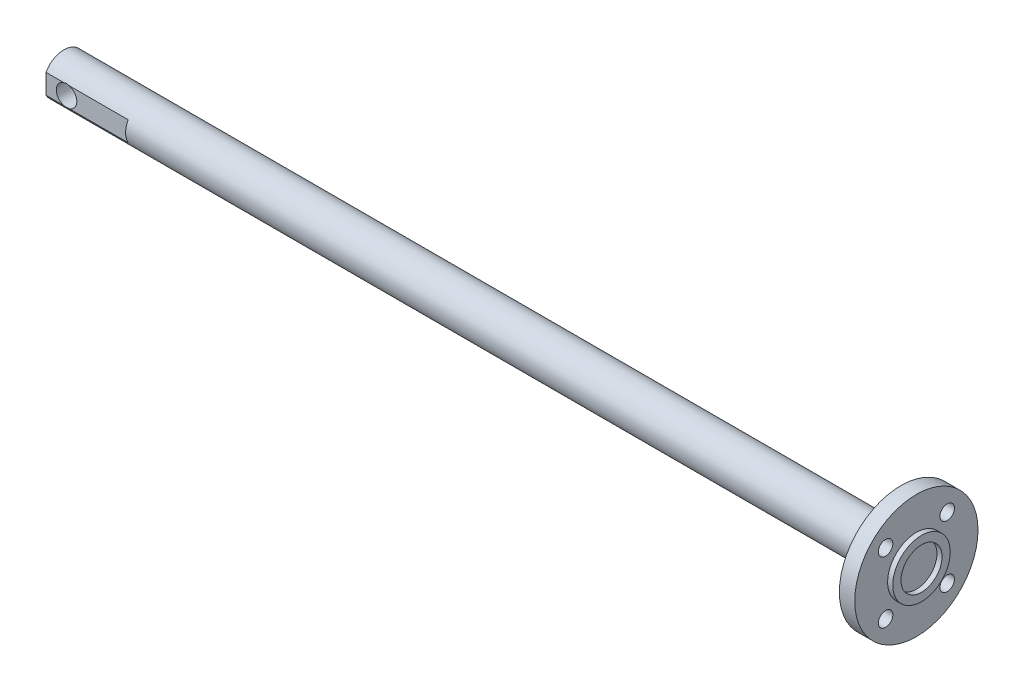
from build123d import *

# Parameters (mm, degrees)
SKETCH1_R                       = 19.05
BOSS_EXTRUDE1_DEPTH             = 263.525
SKETCH2_W                       = 258.7625
SKETCH2_H                       = 12.7
CUT_EXTRUDE1_DEPTH              = 265.898528922
CUT_EXTRUDE1_DEPTH_BACK         = 265.898528922
SKETCH8_W                       = 25.4
SKETCH8_H                       = 0.79375
F_1_1_DIAMETER_HOLE2_D          = 6.35
F_16_0_177_DIAMETER_HOLE1_D     = 4.4958
F_16_0_177_DIAMETER_HOLE1_DEPTH = 25.4
F_16_0_177_DIAMETER_HOLE1_TIP   = 1.350674586
BOSS_EXTRUDE2_START             = 1.5875
SKETCH15_R                      = 8.89
SKETCH15_R_2                    = 6.35
BOSS_EXTRUDE2_DEPTH             = 1.5875


with BuildPart() as part:
    # Sketch1 → Boss-Extrude1 (new body)
    with BuildSketch(Plane(origin=(0, 0, 0), x_dir=(0, 0, -1), z_dir=(1, 0, 0))):
        Circle(SKETCH1_R)
    extrude(amount=BOSS_EXTRUDE1_DEPTH)

    # Sketch2 → Cut-Revolve1 (revolve, cut)
    with BuildSketch(Plane.XY):
        with Locations((129.38125, 12.7)):
            Rectangle(SKETCH2_W, SKETCH2_H)
    revolve(axis=Axis((-16.52066387, 0, 0), (1, 0, 0)), mode=Mode.SUBTRACT)

    # Sketch8 → Cut-Extrude1 (cut, two sides: drawn at the far end of the back side and taken through both)
    with BuildSketch(Plane(origin=(0, 0, 0), x_dir=(1, 0, 0), z_dir=(0, 1, 0)).offset(-CUT_EXTRUDE1_DEPTH_BACK)):
        with Locations((12.7, 5.953125)):
            Rectangle(SKETCH8_W, SKETCH8_H)
        with Locations((12.7, -5.953125)):
            Rectangle(SKETCH8_W, SKETCH8_H)
    extrude(amount=CUT_EXTRUDE1_DEPTH + CUT_EXTRUDE1_DEPTH_BACK, mode=Mode.SUBTRACT)

    # 1 (1) Diameter Hole2 (through all)
    with Locations(Plane(origin=(0, 0, -5.55625), x_dir=(-1, 0, 0), z_dir=(0, 0, -1))):
        with Locations((-6.35, 0)):
            Hole(F_1_1_DIAMETER_HOLE2_D / 2)

    # #16 (0.177) Diameter Hole1
    with Locations(Plane.ZY.offset(-258.7625)):
        with Locations((9.525, 9.525), (-9.525, -9.525), (-9.525, 9.525), (9.525, -9.525)):
            Hole(F_16_0_177_DIAMETER_HOLE1_D / 2, depth=F_16_0_177_DIAMETER_HOLE1_DEPTH)
            with Locations((0, 0, -(F_16_0_177_DIAMETER_HOLE1_DEPTH + F_16_0_177_DIAMETER_HOLE1_TIP / 2))):  # 118° drill point
                Cone(0, F_16_0_177_DIAMETER_HOLE1_D / 2, F_16_0_177_DIAMETER_HOLE1_TIP, mode=Mode.SUBTRACT)

    # Sketch15 → Boss-Extrude2 (add)
    with BuildSketch(Plane(origin=(263.525, 0, 0), x_dir=(0, 0, -1), z_dir=(1, 0, 0)).offset(BOSS_EXTRUDE2_START)):
        Circle(SKETCH15_R)
        Circle(SKETCH15_R_2, mode=Mode.SUBTRACT)
    extrude(amount=-BOSS_EXTRUDE2_DEPTH)


solid = part.part
